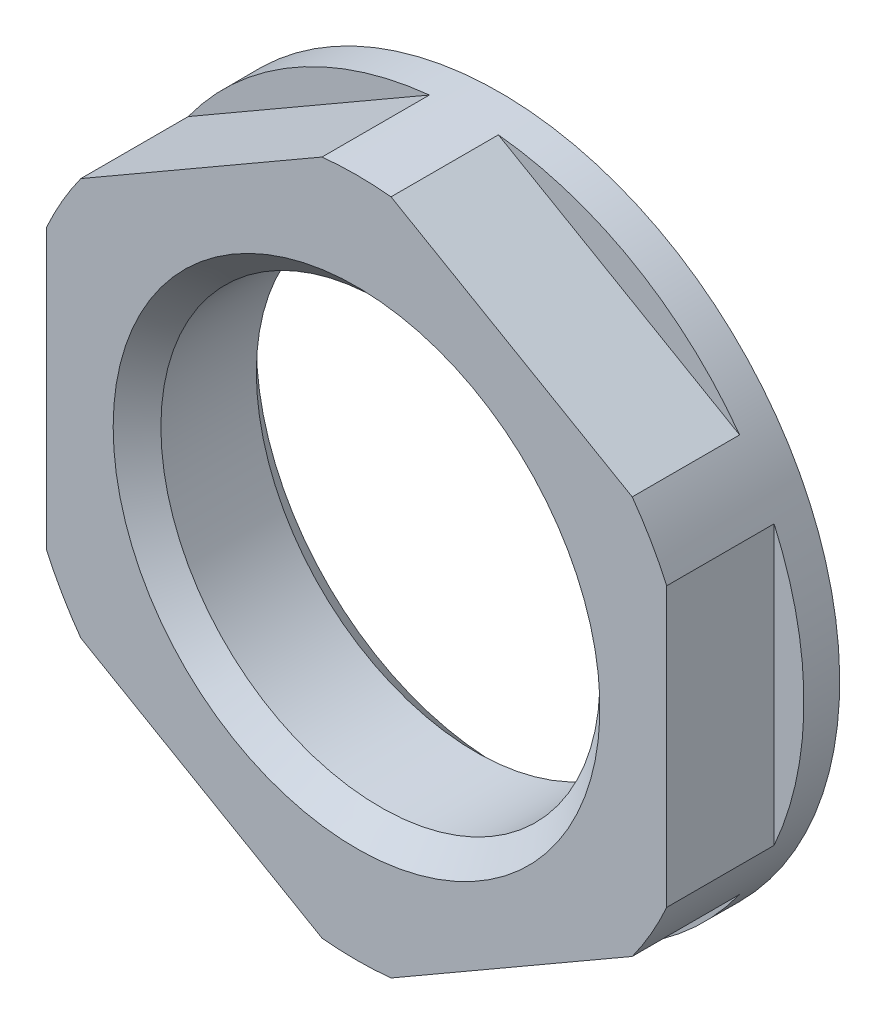
from build123d import *
from build123d.topology import SkipClean

# Parameters (mm, degrees)
EXTRUDE_1_DEPTH     = 6
SKETCH_2_R          = 15.011106999
SKETCH_2_R_2        = 14.25
CUT_EXTRUDE_1_DEPTH = 21.744477177
EXTRUDE_START       = -1.5
SKETCH_4_R          = 14.25
EXTRUDE_3_DEPTH     = 1.5
SKETCH_5_R          = 9.2
CUT_EXTRUDE_2_DEPTH = 22.026768653
CHAMFER_1_SIZE      = 1


with BuildPart() as part:
    # Эскиз1 → Вытянуть1 (new body)
    with BuildSketch(Plane.XY):
        Polygon((0, 15.011106999), (-13, 7.505553499), (-13, -7.505553499), (0, -15.011106999), (13, -7.505553499), (13, 7.505553499), align=None)
    extrude(amount=EXTRUDE_1_DEPTH)

    # Эскиз2 → Вырез-Вытянуть1 (cut, through all)
    with BuildSketch(Plane.XY.offset(6)):
        Circle(SKETCH_2_R)
        Circle(SKETCH_2_R_2, mode=Mode.SUBTRACT)
    extrude(amount=-CUT_EXTRUDE_1_DEPTH, mode=Mode.SUBTRACT)

    # Эскиз4 → Вытянуть3 (add)
    with SkipClean():  # the faces are left unmerged after this step: merging them gives an invalid solid
        with BuildSketch(Plane(origin=(0, 0, 0), x_dir=(-1, 0, 0), z_dir=(0, 0, -1)).offset(EXTRUDE_START)):
            Circle(SKETCH_4_R)
        extrude(amount=EXTRUDE_3_DEPTH)
    add(part.part.scale(1), mode=Mode.REPLACE)  # the faces are merged on a copy

    # Эскиз5 → Вырез-Вытянуть2 (cut, through all)
    with BuildSketch(Plane.XY.offset(6)):
        Circle(SKETCH_5_R)
    extrude(amount=-CUT_EXTRUDE_2_DEPTH, mode=Mode.SUBTRACT)

    # Фаска1
    chamfer_1_edges = [part.edges().sort_by_distance(p)[0] for p in [
        (-9.2, 0, 0),
        (-9.2, 0, 6),
    ]]
    chamfer(chamfer_1_edges, length=CHAMFER_1_SIZE)


solid = part.part
